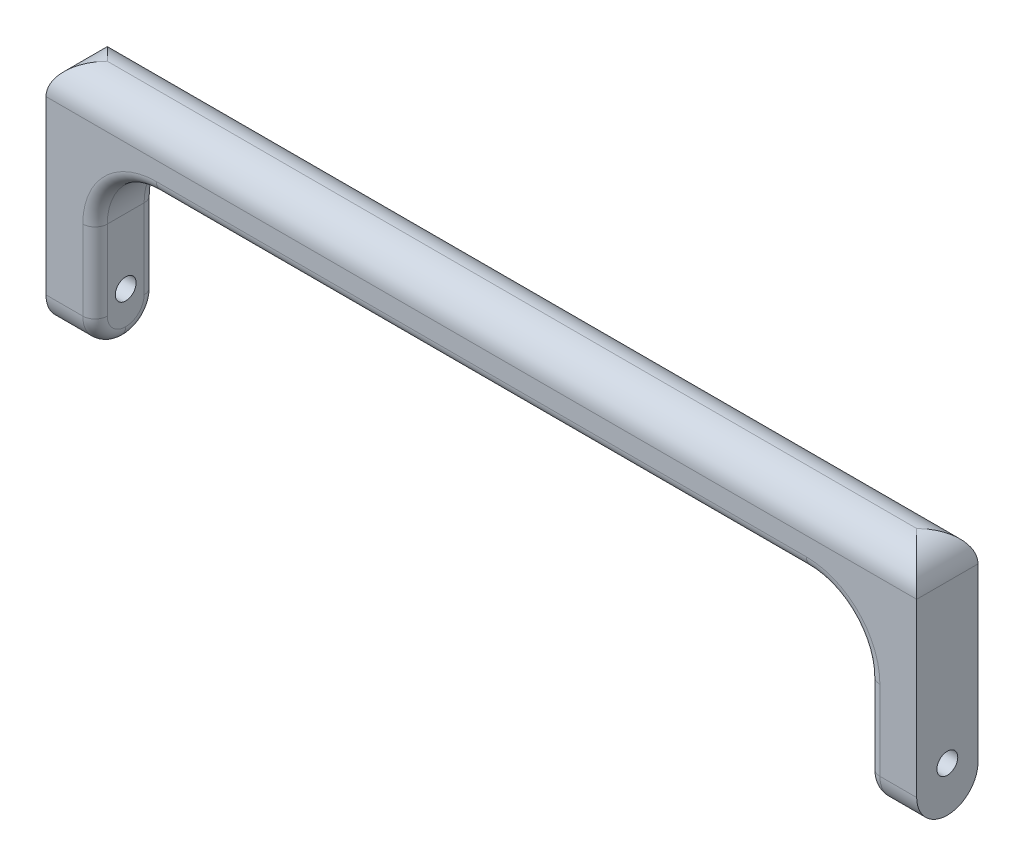
from build123d import *

# Parameters (mm, degrees)
BOSS_EXTRUDE1_DEPTH = 5
FILLET1_R           = 5
FILLET2_R           = 5
FILLET3_R           = 2
SKETCH2_R           = 1.7
CUT_EXTRUDE1_DEPTH  = 147


with BuildPart() as part:
    # Sketch1 → Boss-Extrude1 (new, symmetric)
    with BuildSketch(Plane.XY):
        with BuildLine():
            ThreePointArc((-63, -10), (-60.071067812, -2.928932188), (-53, 0))
            Line((-53, 0), (0, 0))
            Line((0, 0), (0, 10))
            Line((0, 10), (-71, 10))
            Line((-71, 10), (-71, 0))
            Line((-71, 0), (-71, -28))
            Line((-71, -28), (-63, -28))
            Line((-63, -28), (-63, -10))
        make_face()
        with BuildLine():
            Line((0, 10), (0, 0))
            Line((0, 0), (53, 0))
            ThreePointArc((53, 0), (60.071067812, -2.928932188), (63, -10))
            Line((63, -10), (63, -28))
            Line((63, -28), (71, -28))
            Line((71, -28), (71, 0))
            Line((71, 0), (71, 10))
            Line((71, 10), (0, 10))
        make_face()
    extrude(amount=BOSS_EXTRUDE1_DEPTH, both=True)

    # Fillet1
    fillet1_edges = [part.edges().sort_by_distance(p)[0] for p in [
        (-67, -28, -5),
        (-67, -28, 5),
        (67, -28, -5),
        (67, -28, 5),
    ]]
    fillet(fillet1_edges, radius=FILLET1_R - 0.0001)  # a hair under: the kernel refuses the full size

    # Fillet2
    fillet2_edges = [part.edges().sort_by_distance(p)[0] for p in [
        (0, 10, -5),
        (-71, 10, 0),
        (71, 10, 0),
        (0, 10, 5),
    ]]
    fillet(fillet2_edges, radius=FILLET2_R - 0.0001)  # a hair under: the kernel refuses the full size

    # Fillet3
    fillet3_edges = [part.edges().sort_by_distance(p)[0] for p in [
        (0, 0, 5),
        (-63, -16.50005, -5),
        (63, -16.50005, -5),
        (60.071067812, -2.928932188, -5),
        (60.071067812, -2.928932188, 5),
        (0, 0, -5),
        (-60.071067812, -2.928932188, -5),
        (63, -16.50005, 5),
        (-63, -26.535563195, 3.535563195),
        (-63, -26.535563195, -3.535563195),
        (63, -26.535563195, 3.535563195),
        (63, -26.535563195, -3.535563195),
        (-60.071067812, -2.928932188, 5),
        (-63, -16.50005, 5),
    ]]
    fillet(fillet3_edges, radius=FILLET3_R)

    # Sketch2 → Cut-Extrude1 (cut)
    with BuildSketch(Plane(origin=(71, 0, 0), x_dir=(0, 0, -1), z_dir=(1, 0, 0))):
        with Locations((0, -20.652619003)):
            Circle(SKETCH2_R)
    extrude(amount=-CUT_EXTRUDE1_DEPTH, mode=Mode.SUBTRACT)


solid = part.part
